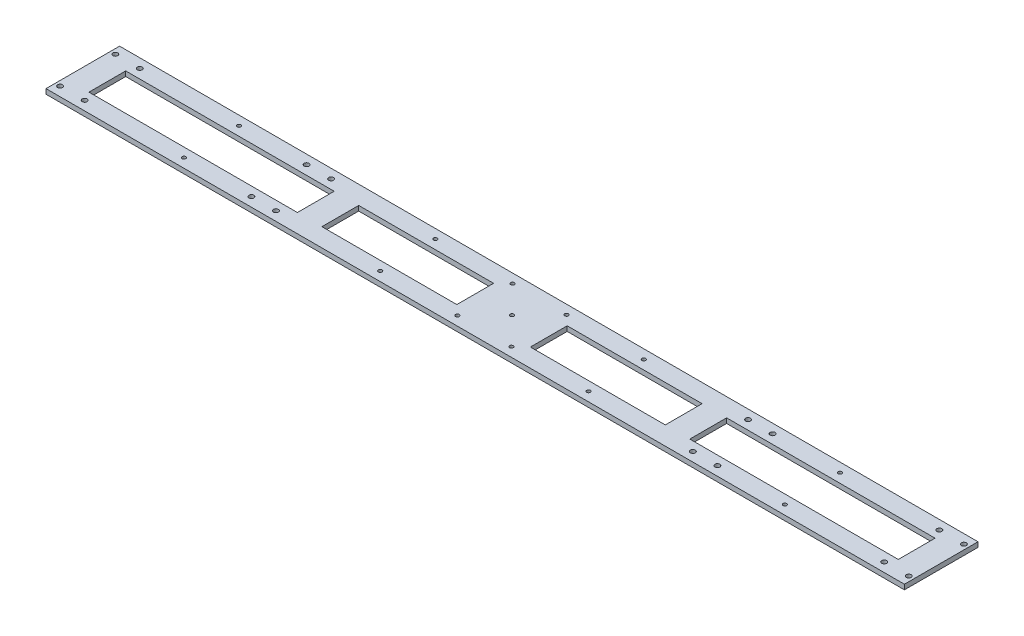
from build123d import *

# Parameters (mm, degrees)
SKETCH_1_W                                 = 700
SKETCH_1_H                                 = 60
SKETCH_1_W_2                               = 280
SKETCH_1_H_2                               = 30
EXTRUDE_1_DEPTH                            = 4
SKETCH_2_W                                 = 170
SKETCH_2_H                                 = 30
CUT_EXTRUDE_1_DEPTH                        = 4
SKETCH_3_R                                 = 2
CUT_EXTRUDE_2_DEPTH                        = 4
MIRROR_2_AT_THE_SECOND_PLANE_COPY_1_SKET_R = 2
MIRROR_2_AT_THE_SECOND_PLANE_COPY_1_DEPTH  = 4
SKETCH_4_W                                 = 60
SKETCH_4_H                                 = 30
EXTRUDE_2_DEPTH                            = 4
SKETCH_5_R                                 = 1.5
CUT_EXTRUDE_3_DEPTH                        = 4
MIRROR_3_AT_THE_SECOND_PLANE_COPY_1_SKET_R = 1.5
MIRROR_3_AT_THE_SECOND_PLANE_COPY_1_DEPTH  = 4


with BuildPart() as part:
    # 草图1 → 凸台-拉伸1 (new body)
    with BuildSketch(Plane(origin=(0, 0, 0), x_dir=(1, 0, 0), z_dir=(0, 1, 0))):
        Rectangle(SKETCH_1_W, SKETCH_1_H)
        Rectangle(SKETCH_1_W_2, SKETCH_1_H_2, mode=Mode.SUBTRACT)
    extrude(amount=EXTRUDE_1_DEPTH)

    # 草图2 → 切除-拉伸1 (cut)
    with BuildSketch(Plane(origin=(0, 4, 0), x_dir=(1, 0, 0), z_dir=(0, 1, 0))):
        with Locations((-245, 0)):
            Rectangle(SKETCH_2_W, SKETCH_2_H)
    cut_extrude_1 = extrude(amount=-CUT_EXTRUDE_1_DEPTH, mode=Mode.SUBTRACT)

    # 镜向1: 切除-拉伸1 across plane
    add(cut_extrude_1.mirror(Plane(origin=(0, 0, 0), x_dir=(0, 0, 1), z_dir=(1, 0, 0))), mode=Mode.SUBTRACT)

    # 草图3 → 切除-拉伸2 (cut)
    with BuildSketch(Plane(origin=(0, 4, 0), x_dir=(1, 0, 0), z_dir=(0, 1, 0))):
        with Locations((-190, 22.5)):
            Circle(SKETCH_3_R)
        with Locations((-170, 22.5)):
            Circle(SKETCH_3_R)
        with Locations((-346, 22.5)):
            Circle(SKETCH_3_R)
        with Locations((-326, 22.5)):
            Circle(SKETCH_3_R)
    cut_extrude_2 = extrude(amount=-CUT_EXTRUDE_2_DEPTH, mode=Mode.SUBTRACT)

    # 镜向2: 切除-拉伸2 across plane
    add(cut_extrude_2.mirror(Plane(origin=(0, 0, 0), x_dir=(0, 0, 1), z_dir=(1, 0, 0))), mode=Mode.SUBTRACT)

    # 镜向2 at the second plane: 切除-拉伸2 across plane
    add(cut_extrude_2.mirror(Plane.XY), mode=Mode.SUBTRACT)

    # 镜向2 at the second plane copy 1 sket → 镜向2 at the second plane copy 1 (cut)
    with BuildSketch(Plane(origin=(0, 4, 0), x_dir=(-1, 0, 0), z_dir=(0, 1, 0))):
        with Locations((-190, 22.5)):
            Circle(MIRROR_2_AT_THE_SECOND_PLANE_COPY_1_SKET_R)
        with Locations((-170, 22.5)):
            Circle(MIRROR_2_AT_THE_SECOND_PLANE_COPY_1_SKET_R)
        with Locations((-346, 22.5)):
            Circle(MIRROR_2_AT_THE_SECOND_PLANE_COPY_1_SKET_R)
        with Locations((-326, 22.5)):
            Circle(MIRROR_2_AT_THE_SECOND_PLANE_COPY_1_SKET_R)
    extrude(amount=-MIRROR_2_AT_THE_SECOND_PLANE_COPY_1_DEPTH, mode=Mode.SUBTRACT)

    # 草图4 → 凸台-拉伸2 (add)
    with BuildSketch(Plane(origin=(0, 4, 0), x_dir=(1, 0, 0), z_dir=(0, 1, 0))):
        Rectangle(SKETCH_4_W, SKETCH_4_H)
    extrude(amount=-EXTRUDE_2_DEPTH)

    # 草图5 → 切除-拉伸3 (cut)
    with BuildSketch(Plane(origin=(0, 4, 0), x_dir=(1, 0, 0), z_dir=(0, 1, 0))):
        with Locations((-245, 22.5)):
            Circle(SKETCH_5_R)
        with Locations((-85, 22.5)):
            Circle(SKETCH_5_R)
        Circle(SKETCH_5_R)
        with Locations((-22, 22.5)):
            Circle(SKETCH_5_R)
    cut_extrude_3 = extrude(amount=-CUT_EXTRUDE_3_DEPTH, mode=Mode.SUBTRACT)

    # 镜向3: 切除-拉伸3 across plane
    add(cut_extrude_3.mirror(Plane.XY), mode=Mode.SUBTRACT)

    # 镜向3 at the second plane: 切除-拉伸3 across plane
    add(cut_extrude_3.mirror(Plane(origin=(0, 0, 0), x_dir=(0, 0, 1), z_dir=(1, 0, 0))), mode=Mode.SUBTRACT)

    # 镜向3 at the second plane copy 1 sket → 镜向3 at the second plane copy 1 (cut)
    with BuildSketch(Plane(origin=(0, 4, 0), x_dir=(-1, 0, 0), z_dir=(0, 1, 0))):
        with Locations((-245, 22.5)):
            Circle(MIRROR_3_AT_THE_SECOND_PLANE_COPY_1_SKET_R)
        with Locations((-85, 22.5)):
            Circle(MIRROR_3_AT_THE_SECOND_PLANE_COPY_1_SKET_R)
        Circle(MIRROR_3_AT_THE_SECOND_PLANE_COPY_1_SKET_R)
        with Locations((-22, 22.5)):
            Circle(MIRROR_3_AT_THE_SECOND_PLANE_COPY_1_SKET_R)
    extrude(amount=-MIRROR_3_AT_THE_SECOND_PLANE_COPY_1_DEPTH, mode=Mode.SUBTRACT)


solid = part.part
